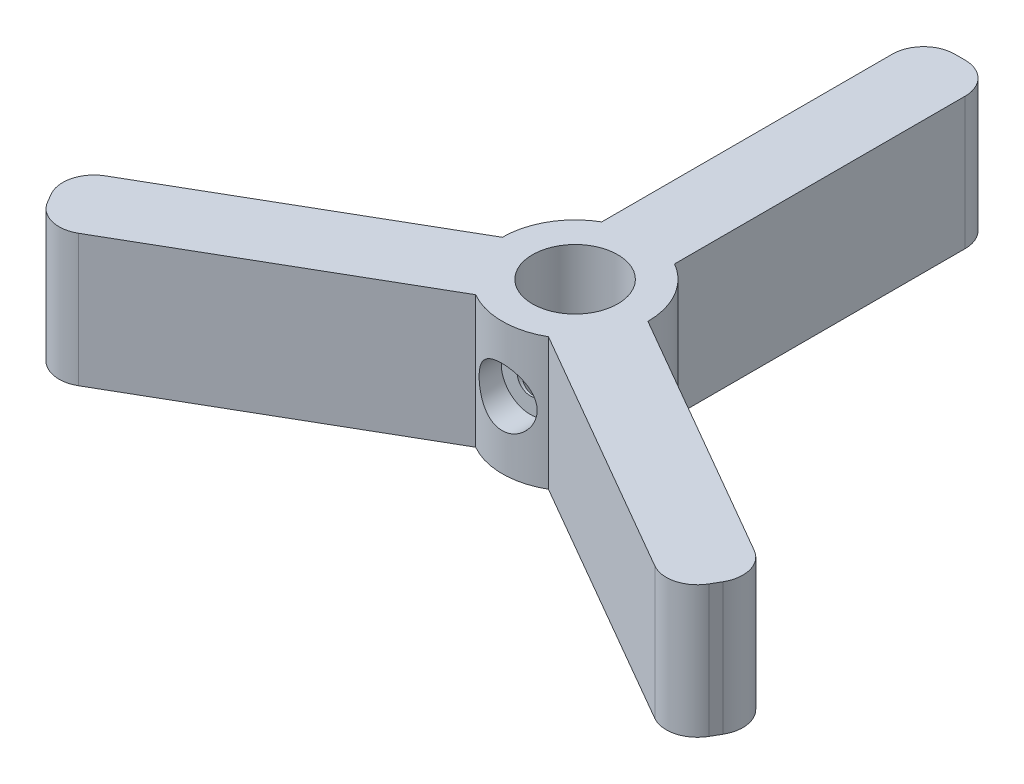
from build123d import *

# Parameters (mm, degrees)
BOSS_EXTRUDE1_DEPTH                               = 12.7
SKETCH2_R                                         = 4.1
CUT_EXTRUDE1_DEPTH                                = 51.982782527
CBORE_FOR_M5_HEX_HEAD_BOLT1_D                     = 2.5
CBORE_FOR_M5_HEX_HEAD_BOLT1_DEPTH                 = 18
CBORE_FOR_M5_HEX_HEAD_BOLT1_CBORE_D               = 5.6
CBORE_FOR_M5_HEX_HEAD_BOLT1_CBORE_DEPTH           = 2.7
CBORE_FOR_M5_HEX_HEAD_BOLT1_TIP                   = 0.751075774
CBORE_FOR_M5_HEX_HEAD_BOLT1_ON_FACE_2_D           = 2.5
CBORE_FOR_M5_HEX_HEAD_BOLT1_ON_FACE_2_DEPTH       = 18
CBORE_FOR_M5_HEX_HEAD_BOLT1_ON_FACE_2_CBORE_D     = 5.6
CBORE_FOR_M5_HEX_HEAD_BOLT1_ON_FACE_2_CBORE_DEPTH = 2.7
CBORE_FOR_M5_HEX_HEAD_BOLT1_ON_FACE_2_TIP         = 0.751075774


with BuildPart() as part:
    # Sketch1 → Boss-Extrude1 (new body)
    with BuildSketch(Plane(origin=(0, 0, 0), x_dir=(1, 0, 0), z_dir=(0, 1, 0))):
        with BuildLine():
            Line((-0.5, 37), (0.5, 37))
            ThreePointArc((0.5, 37), (2.621320344, 36.121320344), (3.5, 34))
            Line((3.5, 34), (3.5, 6.062177826))
            ThreePointArc((3.5, 6.062177826), (6.062177826, 3.5), (7, 0))
            Line((7, 0), (31.194863729, -13.968911087))
            ThreePointArc((31.194863729, -13.968911087), (32.592641208, -15.790530163), (32.29293994, -18.066987298))
            Line((32.29293994, -18.066987298), (31.79293994, -18.933012702))
            ThreePointArc((31.79293994, -18.933012702), (29.971320864, -20.330790181), (27.694863729, -20.031088913))
            Line((27.694863729, -20.031088913), (3.5, -6.062177826))
            ThreePointArc((3.5, -6.062177826), (0, -7), (-3.5, -6.062177826))
            Line((-3.5, -6.062177826), (-27.694863729, -20.031088913))
            ThreePointArc((-27.694863729, -20.031088913), (-29.971320864, -20.330790181), (-31.79293994, -18.933012702))
            Line((-31.79293994, -18.933012702), (-32.29293994, -18.066987298))
            ThreePointArc((-32.29293994, -18.066987298), (-32.592641208, -15.790530163), (-31.194863729, -13.968911087))
            Line((-31.194863729, -13.968911087), (-7, 0))
            ThreePointArc((-7, 0), (-6.062177826, 3.5), (-3.5, 6.062177826))
            Line((-3.5, 6.062177826), (-3.5, 34))
            ThreePointArc((-3.5, 34), (-2.621320344, 36.121320344), (-0.5, 37))
        make_face()
    extrude(amount=BOSS_EXTRUDE1_DEPTH)

    # Sketch2 → Cut-Extrude1 (cut, through all)
    with BuildSketch(Plane(origin=(0, 12.7, 0), x_dir=(1, 0, 0), z_dir=(0, 1, 0))):
        Circle(SKETCH2_R)
    extrude(amount=-CUT_EXTRUDE1_DEPTH, mode=Mode.SUBTRACT)

    # CBORE for M5 Hex Head Bolt1
    with Locations(Plane(origin=(-0.022879542, 6.389773721, 6.999962609), x_dir=(0.99999465842, 0, 0.003268506014), z_dir=(-0.003268506014, 0, 0.99999465842))):
        with Locations((0, 0)):
            CounterBoreHole(CBORE_FOR_M5_HEX_HEAD_BOLT1_D / 2, CBORE_FOR_M5_HEX_HEAD_BOLT1_CBORE_D / 2, CBORE_FOR_M5_HEX_HEAD_BOLT1_CBORE_DEPTH, depth=CBORE_FOR_M5_HEX_HEAD_BOLT1_DEPTH)
            with Locations((0, 0, -(CBORE_FOR_M5_HEX_HEAD_BOLT1_DEPTH + CBORE_FOR_M5_HEX_HEAD_BOLT1_TIP / 2))):  # 118° drill point
                Cone(0, CBORE_FOR_M5_HEX_HEAD_BOLT1_D / 2, CBORE_FOR_M5_HEX_HEAD_BOLT1_TIP, mode=Mode.SUBTRACT)

    # CBORE for M5 Hex Head Bolt1 on face 2
    with Locations(Plane(origin=(1.383929949, -4.684067914, 0), x_dir=(0.99999465842, 0, 0.003268506014), z_dir=(-0.003268506014, 0, 0.99999465842))):
        with Locations((0, 0)):
            CounterBoreHole(CBORE_FOR_M5_HEX_HEAD_BOLT1_ON_FACE_2_D / 2, CBORE_FOR_M5_HEX_HEAD_BOLT1_ON_FACE_2_CBORE_D / 2, CBORE_FOR_M5_HEX_HEAD_BOLT1_ON_FACE_2_CBORE_DEPTH, depth=CBORE_FOR_M5_HEX_HEAD_BOLT1_ON_FACE_2_DEPTH)
            with Locations((0, 0, -(CBORE_FOR_M5_HEX_HEAD_BOLT1_ON_FACE_2_DEPTH + CBORE_FOR_M5_HEX_HEAD_BOLT1_ON_FACE_2_TIP / 2))):  # 118° drill point
                Cone(0, CBORE_FOR_M5_HEX_HEAD_BOLT1_ON_FACE_2_D / 2, CBORE_FOR_M5_HEX_HEAD_BOLT1_ON_FACE_2_TIP, mode=Mode.SUBTRACT)


solid = part.part
